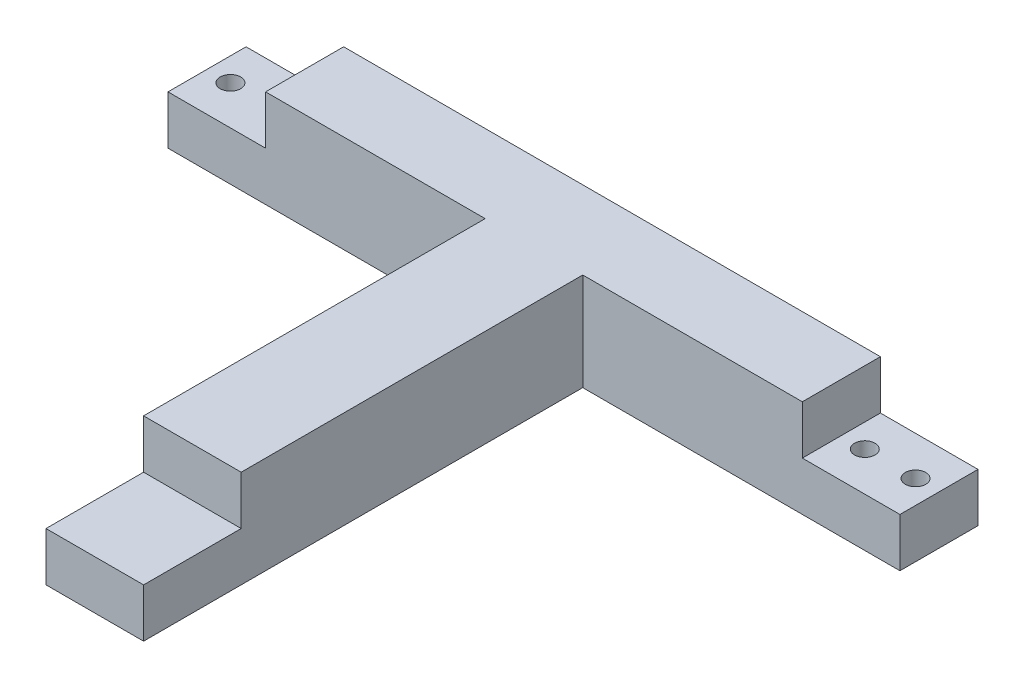
from build123d import *

# Parameters (mm, degrees)
SKETCH_1_W          = 150
SKETCH_1_H          = 16
EXTRUDE_1_DEPTH     = 10
SKETCH_2_W          = 110
SKETCH_2_H          = 16
EXTRUDE_2_DEPTH     = 10
SKETCH_4_R          = 2.1
CUT_EXTRUDE_1_DEPTH = 10
SKETCH_5_R          = 2.1
CUT_EXTRUDE_2_DEPTH = 10
SKETCH_6_W          = 20
SKETCH_6_H          = 20
EXTRUDE_3_DEPTH     = 70
SKETCH_7_W          = 20
SKETCH_7_H          = 10
EXTRUDE_4_DEPTH     = 20


with BuildPart() as part:
    # 草图1 → 凸台-拉伸1 (new body)
    with BuildSketch(Plane(origin=(0, 0, 0), x_dir=(1, 0, 0), z_dir=(0, 1, 0))):
        Rectangle(SKETCH_1_W, SKETCH_1_H)
    extrude(amount=EXTRUDE_1_DEPTH)

    # 草图2 → 凸台-拉伸2 (add)
    with BuildSketch(Plane(origin=(0, 10, 0), x_dir=(1, 0, 0), z_dir=(0, 1, 0))):
        Rectangle(SKETCH_2_W, SKETCH_2_H)
    extrude(amount=EXTRUDE_2_DEPTH)

    # 草图4 → 切除-拉伸1 (cut)
    with BuildSketch(Plane(origin=(0, 10, 0), x_dir=(1, 0, 0), z_dir=(0, 1, 0))):
        with Locations((-70.2, 0)):
            Circle(SKETCH_4_R)
        with Locations((-59.8, 0)):
            Circle(SKETCH_4_R)
    extrude(amount=-CUT_EXTRUDE_1_DEPTH, mode=Mode.SUBTRACT)

    # 草图5 → 切除-拉伸2 (cut)
    with BuildSketch(Plane(origin=(0, 10, 0), x_dir=(1, 0, 0), z_dir=(0, 1, 0))):
        with Locations((59.8, 0)):
            Circle(SKETCH_5_R)
        with Locations((70.2, 0)):
            Circle(SKETCH_5_R)
    extrude(amount=-CUT_EXTRUDE_2_DEPTH, mode=Mode.SUBTRACT)

    # 草图6 → 凸台-拉伸3 (add)
    with BuildSketch(Plane.XY.offset(8)):
        with Locations((0, 10)):
            Rectangle(SKETCH_6_W, SKETCH_6_H)
    extrude(amount=EXTRUDE_3_DEPTH)

    # 草图7 → 凸台-拉伸4 (add)
    with BuildSketch(Plane.XY.offset(78)):
        with Locations((0, 5)):
            Rectangle(SKETCH_7_W, SKETCH_7_H)
    extrude(amount=EXTRUDE_4_DEPTH)


solid = part.part
